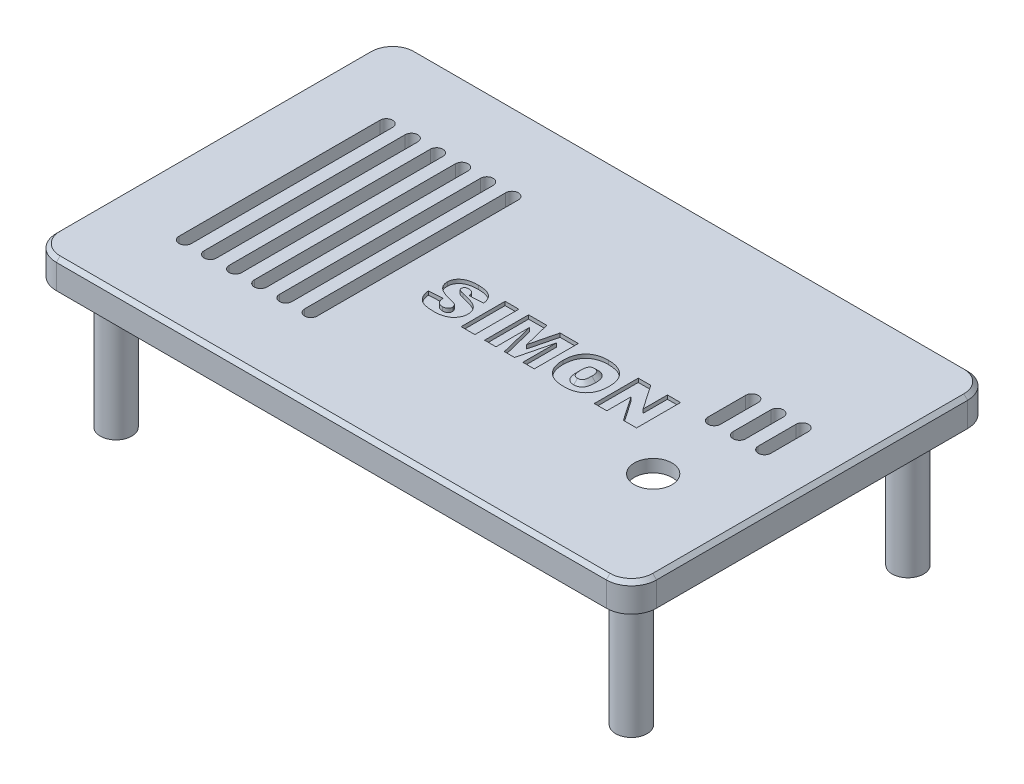
from build123d import *

# Parameters (mm, degrees)
TAPA_DEPTH                        = 2
ESCALON_GROOVE_START              = -2.5
ESCALON_GROOVE_DEPTH              = 2.5
CROQUIS_POSTES_R                  = 2.500000000000002
POSTES_PCB_DEPTH                  = 23.299999999999997
VENTANA_LDR_Y_VENTILAS_DEPTH      = 61.4112158460662
VENTANA_LDR_Y_VENTILAS_DEPTH_BACK = 61.4112158460662
CROQUIS_VENTANA_Y_VENTILAS_R      = 3.0000000000000027
CROQUIS_TEXTO_W                   = 2.1818181818181825
CROQUIS_TEXTO_H                   = 7.000000000000001
TEXTO_SIMON_DEPTH                 = 0.6
CHAFLAN_CARA_SUPERIOR_SIZE        = 0.6


with BuildPart() as part:
    # Croquis_tapa → Tapa (new body)
    with BuildSketch(Plane(origin=(0, 0, 0), x_dir=(1, 0, 0), z_dir=(0, 1, 0))):
        with BuildLine():
            Line((-43.75000000000001, -28.75), (43.75000000000001, -28.75))
            ThreePointArc((43.75000000000001, -28.75), (46.5784271247462, -27.57842712474619), (47.75, -24.75))
            Line((47.75, -24.75), (47.75, 24.75))
            ThreePointArc((47.75, 24.75), (46.57842712474619, 27.578427124746185), (43.75000000000001, 28.75))
            Line((43.75000000000001, 28.75), (-43.75000000000001, 28.75))
            ThreePointArc((-43.75000000000001, 28.75), (-46.5784271247462, 27.57842712474619), (-47.75, 24.75))
            Line((-47.75, 24.75), (-47.75, -24.75))
            ThreePointArc((-47.75, -24.75), (-46.57842712474619, -27.578427124746185), (-43.75000000000001, -28.75))
        make_face()
    extrude(amount=TAPA_DEPTH)

    # Croquis_falda → Escalon_groove (add)
    with BuildSketch(Plane(origin=(0, 0, 0), x_dir=(1, 0, 0), z_dir=(0, 1, 0)).offset(ESCALON_GROOVE_START)):
        with BuildLine():
            Line((-43.75000000000001, -28.75), (43.75000000000001, -28.75))
            ThreePointArc((43.75000000000001, -28.75), (46.5784271247462, -27.57842712474619), (47.75, -24.75))
            Line((47.75, -24.75), (47.75, 24.75))
            ThreePointArc((47.75, 24.75), (46.57842712474619, 27.578427124746185), (43.75000000000001, 28.75))
            Line((43.75000000000001, 28.75), (-43.75000000000001, 28.75))
            ThreePointArc((-43.75000000000001, 28.75), (-46.5784271247462, 27.57842712474619), (-47.75, 24.75))
            Line((-47.75, 24.75), (-47.75, -24.75))
            ThreePointArc((-47.75, -24.75), (-46.57842712474619, -27.578427124746185), (-43.75000000000001, -28.75))
        make_face()
        with BuildLine():
            Line((-43.75000000000001, -27.7), (43.75000000000001, -27.7))
            ThreePointArc((43.75000000000001, -27.7), (45.83596500450032, -26.835965004500316), (46.7, -24.75))
            Line((46.7, -24.75), (46.7, 24.75))
            ThreePointArc((46.7, 24.75), (45.835965004500316, 26.835965004500313), (43.75000000000001, 27.7))
            Line((43.75000000000001, 27.7), (-43.75000000000001, 27.7))
            ThreePointArc((-43.75000000000001, 27.7), (-45.83596500450032, 26.835965004500316), (-46.7, 24.75))
            Line((-46.7, 24.75), (-46.7, -24.75))
            ThreePointArc((-46.7, -24.75), (-45.83596500450032, -26.835965004500313), (-43.75000000000001, -27.7))
        make_face(mode=Mode.SUBTRACT)
    extrude(amount=ESCALON_GROOVE_DEPTH)

    # Croquis_postes → Postes_PCB (add)
    with BuildSketch(Plane(origin=(0, 0, 0), x_dir=(1, 0, 0), z_dir=(0, 1, 0))):
        with Locations(Location((41, 22, 0), (0, 0, 270))):
            Circle(CROQUIS_POSTES_R)
        with Locations(Location((41, -22, 0), (0, 0, 270))):
            Circle(CROQUIS_POSTES_R)
        with Locations(Location((-41, 22, 0), (0, 0, 270))):
            Circle(CROQUIS_POSTES_R)
        with Locations(Location((-41, -22, 0), (0, 0, 270))):
            Circle(CROQUIS_POSTES_R)
    extrude(amount=-POSTES_PCB_DEPTH)

    # Croquis_ventana_y_ventilas → Ventana_LDR_y_ventilas (cut, two sides: drawn at the far end of the back side and taken through both)
    with BuildSketch(Plane(origin=(0, 0, 0), x_dir=(1, 0, 0), z_dir=(0, 1, 0)).offset(-VENTANA_LDR_Y_VENTILAS_DEPTH_BACK)):
        with Locations(Location((33.46, -11, 0), (0, 0, 270))):
            Circle(CROQUIS_VENTANA_Y_VENTILAS_R)
        with BuildLine():
            Line((-17, -16), (-17, 16))
            ThreePointArc((-17, 16), (-16, 17), (-15, 16))
            Line((-15, 16), (-15, -16))
            ThreePointArc((-15, -16), (-16, -17), (-17, -16))
        make_face()
        with BuildLine():
            Line((-21, -16.000000000000007), (-21, 15.999999999999993))
            ThreePointArc((-21, 15.999999999999993), (-20, 16.999999999999993), (-19, 15.999999999999993))
            Line((-19, 15.999999999999993), (-19, -16.000000000000007))
            ThreePointArc((-19, -16.000000000000007), (-20, -17.000000000000007), (-21, -16.000000000000007))
        make_face()
        with BuildLine():
            Line((-25, -16.000000000000014), (-25, 15.999999999999986))
            ThreePointArc((-25, 15.999999999999986), (-24, 16.999999999999986), (-23, 15.999999999999986))
            Line((-23, 15.999999999999986), (-23, -16.000000000000014))
            ThreePointArc((-23, -16.000000000000014), (-24, -17.000000000000014), (-25, -16.000000000000014))
        make_face()
        with BuildLine():
            Line((-29, -16.00000000000002), (-29, 15.999999999999979))
            ThreePointArc((-29, 15.999999999999979), (-28, 16.99999999999998), (-27, 15.999999999999979))
            Line((-27, 15.999999999999979), (-27, -16.00000000000002))
            ThreePointArc((-27, -16.00000000000002), (-28, -17.00000000000002), (-29, -16.00000000000002))
        make_face()
        with BuildLine():
            Line((-33, -16.00000000000003), (-33, 15.999999999999973))
            ThreePointArc((-33, 15.999999999999973), (-32, 16.99999999999997), (-31, 15.999999999999973))
            Line((-31, 15.999999999999973), (-31, -16.00000000000003))
            ThreePointArc((-31, -16.00000000000003), (-32, -17.00000000000003), (-33, -16.00000000000003))
        make_face()
        with BuildLine():
            Line((-37.00000000000001, -16.000000000000036), (-37.00000000000001, 15.999999999999966))
            ThreePointArc((-37.00000000000001, 15.999999999999966), (-36.00000000000001, 16.99999999999997), (-35, 15.999999999999966))
            Line((-35, 15.999999999999966), (-35, -16.000000000000036))
            ThreePointArc((-35, -16.000000000000036), (-36.00000000000001, -17.000000000000036), (-37.00000000000001, -16.000000000000036))
        make_face()
        with BuildLine():
            Line((30, 1.18), (30, 7.18))
            ThreePointArc((30, 7.18), (31, 8.18), (32, 7.18))
            Line((32, 7.18), (32, 1.18))
            ThreePointArc((32, 1.18), (31, 0.17999999999999994), (30, 1.18))
        make_face()
        with BuildLine():
            Line((34, 1.18), (34, 7.18))
            ThreePointArc((34, 7.18), (35, 8.180000000000007), (36.00000000000001, 7.18))
            Line((36.00000000000001, 7.18), (36.00000000000001, 1.18))
            ThreePointArc((36.00000000000001, 1.18), (35, 0.17999999999999994), (34, 1.18))
        make_face()
        with BuildLine():
            Line((38, 1.18), (38, 7.18))
            ThreePointArc((38, 7.18), (39, 8.18), (40, 7.18))
            Line((40, 7.18), (40, 1.18))
            ThreePointArc((40, 1.18), (39, 0.17999999999999994), (38, 1.18))
        make_face()
    extrude(amount=VENTANA_LDR_Y_VENTILAS_DEPTH + VENTANA_LDR_Y_VENTILAS_DEPTH_BACK, mode=Mode.SUBTRACT)

    # Croquis_texto → Texto_SIMON (cut)
    # profile 1 of 5: a face of its own
    with BuildSketch(Plane(origin=(0, 2, 0), x_dir=(1, 0, 0), z_dir=(0, 1, 0))):
        with BuildLine():
            Line((-9.636363636363637, -3.673295454545454), (-7.454545454545455, -3.5454545454545454))
            add(Edge.make_bspline(
                [(-7.454545454545455, -3.5454545454545454), (-7.443334879168272, -3.623888172631611), (-7.422138415725998, -3.772187029306458), (-7.367963968321025, -3.978497338687695), (-7.299675120562156, -4.156745220271855), (-7.235906679516529, -4.257902176777443), (-7.205965909090909, -4.3053977272727275)],
                knots=[0, 0, 0, 0, 1.1770868639817493, 2.2255841329561408, 3.166870363402418, 3.9999999999999996, 3.9999999999999996, 3.9999999999999996, 3.9999999999999996], degree=3))
            add(Edge.make_bspline(
                [(-7.205965909090909, -4.3053977272727275), (-7.179788136074212, -4.339245246532298), (-7.128590569553015, -4.405443032637478), (-7.038959563551368, -4.491551022292443), (-6.941728468338179, -4.564655482865963), (-6.836351920691705, -4.624657492520284), (-6.7225094161414445, -4.670401084517026), (-6.600897908066968, -4.702899356221522), (-6.470842928730454, -4.723176034233415), (-6.381231068109656, -4.725883039430784), (-6.3352272727272725, -4.7272727272727275)],
                knots=[0, 0, 0, 0, 1.0183953625098916, 1.9917417835245903, 2.950663556748308, 3.9105802343792413, 4.872152798487884, 5.865559653282376, 6.904248206810336, 8, 8, 8, 8], degree=3))
            add(Edge.make_bspline(
                [(-6.3352272727272725, -4.7272727272727275), (-6.268755987561935, -4.724527547837119), (-6.142081216189316, -4.71929604108172), (-5.963166534666255, -4.680680424342079), (-5.809111818670184, -4.6113955866092065), (-5.680697914780001, -4.517120500014326), (-5.582820117951429, -4.402639676289624), (-5.506907512844863, -4.280522336689352), (-5.462733749523046, -4.146860477539383), (-5.4572818673821395, -4.054753254710224), (-5.454545454545454, -4.008522727272727)],
                knots=[0, 0, 0, 0, 1.255494895783263, 2.392604994581436, 3.4334622420041474, 4.424586181737781, 5.3754559945137474, 6.262142743519165, 7.127733362157612, 8, 8, 8, 8], degree=3))
            add(Edge.make_bspline(
                [(-5.454545454545454, -4.008522727272727), (-5.457042638060894, -3.9642188454008944), (-5.461992267179779, -3.876404801124006), (-5.500792405763518, -3.748839170668373), (-5.564055951819271, -3.6286714006327605), (-5.623106642104371, -3.5586562456175215), (-5.653409090909091, -3.5227272727272725)],
                knots=[0, 0, 0, 0, 0.9883148386515781, 1.9589236729170945, 2.9526013902743147, 4, 4, 4, 4], degree=3))
            add(Edge.make_bspline(
                [(-5.653409090909091, -3.5227272727272725), (-5.672796040636891, -3.504573296140464), (-5.715720269131202, -3.464378966963703), (-5.798824742560139, -3.413369120195042), (-5.901181072722431, -3.360762396750202), (-6.025102965381517, -3.310554621350773), (-6.169482323778489, -3.2612092967013973), (-6.334241626646502, -3.2114276061604117), (-6.52070539191982, -3.1637005515103014), (-6.652387590259261, -3.133676403076435), (-6.721590909090909, -3.117897727272727)],
                knots=[0, 0, 0, 0, 0.5512304499143283, 1.2204674854659632, 2.017678125629164, 2.944918582915026, 3.9976076496643045, 5.190855942878632, 6.523702563592668, 7.999999999999999, 7.999999999999999, 7.999999999999999, 7.999999999999999], degree=3))
            add(Edge.make_bspline(
                [(-6.721590909090909, -3.117897727272727), (-6.836435564016809, -3.09146247115067), (-7.058221729738386, -3.040411126192894), (-7.375736164808842, -2.949680781612333), (-7.668394483475909, -2.8560924360017523), (-7.9353165507370385, -2.7534686658991365), (-8.176903725721141, -2.644644561531827), (-8.393182897093535, -2.5300443870251064), (-8.584944625542091, -2.4099229459496834), (-8.697283245167544, -2.319259761792594), (-8.751420454545455, -2.2755681818181817)],
                knots=[0, 0, 0, 0, 1.2752657802061986, 2.462772933144874, 3.57286581951249, 4.5997375036263355, 5.556111329171218, 6.438742692037826, 7.247613028754068, 8, 8, 8, 8], degree=3))
            add(Edge.make_bspline(
                [(-8.751420454545455, -2.2755681818181817), (-8.800207842772847, -2.2310769800005468), (-8.896161431118928, -2.143573003679166), (-9.02139750812741, -1.9977483179322726), (-9.128119336944392, -1.8434502041239278), (-9.21285732894506, -1.6791740161465678), (-9.281027625940188, -1.506655483934994), (-9.328747533654775, -1.3250198895494663), (-9.357907758951438, -1.1339886644771786), (-9.36170068579192, -1.0038929133587353), (-9.363636363636363, -0.9375)],
                knots=[0, 0, 0, 0, 1.0411739214007056, 2.0477499919674957, 3.0259724410385243, 3.995164289565199, 4.958114780489323, 5.947685897473527, 6.952624422992133, 8, 8, 8, 8], degree=3))
            add(Edge.make_bspline(
                [(-9.363636363636363, -0.9375), (-9.359695985294676, -0.8495949654654166), (-9.3518140267966, -0.6737580853760523), (-9.291448831405713, -0.41500705324892695), (-9.192860981080903, -0.16446909573423832), (-9.081046842366272, 0.03536937585750832), (-8.97319111303511, 0.1889129469366951), (-8.880434992723893, 0.2986524729188811), (-8.777352851242092, 0.40122737568511785), (-8.664796719132505, 0.49802563129663674), (-8.542756590358065, 0.5885770992307596), (-8.411293682496703, 0.6734607791582755), (-8.268889740525212, 0.7489398439230583), (-8.117435381397556, 0.8212836060855373), (-7.95334164362542, 0.8853222885745315), (-7.775261745357778, 0.9404060881561882), (-7.582655139782734, 0.9872546186625996), (-7.375804490401286, 1.0249602094546093), (-7.154455825349969, 1.0548550960355996), (-6.918886416499556, 1.0756437401883716), (-6.668707730712644, 1.0886401361356999), (-6.497175747200471, 1.0901392620796508), (-6.409090909090909, 1.0909090909090913)],
                knots=[0, 0, 0, 0, 1.3090717199279431, 2.618542706502086, 3.93669142772237, 5.310779260025486, 6.019465884265697, 6.73046699421611, 7.44892136871403, 8.184394081775846, 8.940790576948082, 9.711951076898002, 10.513842775099734, 11.340797704352406, 12.212135637171828, 13.13605295778236, 14.116643754116284, 15.164270918131468, 16.267925536227978, 17.44397513047766, 18.687434073658263, 20, 20, 20, 20], degree=3))
            add(Edge.make_bspline(
                [(-6.409090909090909, 1.0909090909090913), (-6.301080019374197, 1.0899294320415263), (-6.091867679987706, 1.0880318759337897), (-5.787996362405475, 1.0625112910304502), (-5.503686717643599, 1.0253859653249333), (-5.239014564214066, 0.972136817661253), (-4.994777718848705, 0.9017982358196842), (-4.768877845667273, 0.8194108730549894), (-4.563912609920191, 0.7177374613887577), (-4.376824030582997, 0.6025602840618627), (-4.20898282249446, 0.46907144751620616), (-4.058740130804281, 0.31786617801805633), (-3.92774811279431, 0.14760162871200486), (-3.8143817221546223, -0.04064876416237256), (-3.7199495550460124, -0.2473441562765462), (-3.6415021356573014, -0.4716123671508302), (-3.581375451310744, -0.7141765689827172), (-3.557651385223595, -0.8832484705463705), (-3.5454545454545454, -0.9701704545454545)],
                knots=[0, 0, 0, 0, 1.3115156678148931, 2.5403481234645695, 3.7009575805541344, 4.792716182989153, 5.815693948855718, 6.785616820490555, 7.708932939056227, 8.589794160376693, 9.449314928461911, 10.307353016100883, 11.172377749673979, 12.052130673662482, 12.97072446773444, 13.927412188468951, 14.934456625113587, 16, 16, 16, 16], degree=3))
            Line((-3.5454545454545454, -0.9701704545454545), (-5.727272727272727, -1.0909090909090904))
            add(Edge.make_bspline(
                [(-5.727272727272727, -1.0909090909090904), (-5.741071735226454, -1.0166260944800347), (-5.767049551845123, -0.8767819791936254), (-5.83166791352429, -0.6840544886166381), (-5.919392345109169, -0.5242321159653845), (-6.028951493814268, -0.3955275962083252), (-6.160680945127358, -0.29785826259322973), (-6.314647030399677, -0.22895623209763424), (-6.4909734610531595, -0.18977953933333805), (-6.615331183199284, -0.1845528790667585), (-6.6803977272727275, -0.18181818181818143)],
                knots=[0, 0, 0, 0, 1.2345229490025666, 2.324095390644541, 3.3084612467630055, 4.197778927427227, 5.066467890217188, 5.967370860889678, 6.936486201399829, 7.999999999999999, 7.999999999999999, 7.999999999999999, 7.999999999999999], degree=3))
            add(Edge.make_bspline(
                [(-6.6803977272727275, -0.18181818181818143), (-6.733575955985485, -0.18349207231177422), (-6.833785527776119, -0.18664636785052544), (-6.974617533331878, -0.21610329014979843), (-7.09462398573231, -0.26718958650149705), (-7.193066179924691, -0.337742885425528), (-7.268709490148404, -0.42252617687975474), (-7.325043242758786, -0.5166045255795823), (-7.356554859599625, -0.6211632758004495), (-7.361254029871722, -0.693460953361109), (-7.363636363636364, -0.7301136363636364)],
                knots=[0, 0, 0, 0, 1.2953495816680956, 2.4409693598349427, 3.4852848728728163, 4.452772794322755, 5.368250368663451, 6.2373621078105375, 7.106397188810696, 8, 8, 8, 8], degree=3))
            add(Edge.make_bspline(
                [(-7.363636363636364, -0.7301136363636364), (-7.361767954008994, -0.7574078549645263), (-7.358014496259981, -0.8122393516609977), (-7.325203290960944, -0.8911520894264557), (-7.275285411588779, -0.9664041668339952), (-7.228822839343832, -1.0080624651916774), (-7.204545454545455, -1.0298295454545447)],
                knots=[0, 0, 0, 0, 0.9313593215496262, 1.8710125506619575, 2.887572404170655, 4, 4, 4, 4], degree=3))
            add(Edge.make_bspline(
                [(-7.204545454545455, -1.0298295454545447), (-7.189610486380151, -1.041496335709884), (-7.1572585020302615, -1.0667688245144495), (-7.099372758826626, -1.101115579441741), (-7.027487715433766, -1.1330406178639936), (-6.943105165478338, -1.1653475814897372), (-6.845273239563917, -1.1965454926950436), (-6.734770744085803, -1.2273205662121507), (-6.611338994155007, -1.2589560578729204), (-6.524226133367083, -1.2773286583364538), (-6.478693181818182, -1.2869318181818181)],
                knots=[0, 0, 0, 0, 0.5855837203052892, 1.2684858210062226, 2.0741956093958027, 3.0148962604420184, 4.061191977223796, 5.247631417213221, 6.561366666285349, 8, 8, 8, 8], degree=3))
            add(Edge.make_bspline(
                [(-6.478693181818182, -1.2869318181818181), (-6.364526256776745, -1.31224472088474), (-6.1444039954519845, -1.3610498663473023), (-5.826760073454946, -1.4358018025243373), (-5.535022954526224, -1.5121436462538516), (-5.2684636193855265, -1.5891589814880407), (-5.026409258501662, -1.6649963076471896), (-4.810206064464688, -1.743107815314852), (-4.617986928748538, -1.8190808968224257), (-4.450085450232665, -1.898301179332722), (-4.299070861010282, -1.9790268396699278), (-4.161416279669968, -2.064522383815481), (-4.033381618457984, -2.153544589975777), (-3.9159056507473378, -2.24774584512524), (-3.8095188004297333, -2.347393544344418), (-3.712478310377793, -2.4507673952595863), (-3.626497299891709, -2.559614982933532), (-3.5271392891491953, -2.7101729504683245), (-3.4251386011442784, -2.909072757506448), (-3.335763095013531, -3.1619935962959356), (-3.2818887337364093, -3.4295383847610603), (-3.2758111503039555, -3.612916487933229), (-3.2727272727272725, -3.705965909090909)],
                knots=[0, 0, 0, 0, 1.59216922401928, 3.069819826325439, 4.442701820227377, 5.697484839518971, 6.847378755218487, 7.895511839985007, 8.826870635109142, 9.660312258422223, 10.421783000006778, 11.157070095266254, 11.865294080332674, 12.543880036336077, 13.205252393812037, 13.848401971930857, 14.472630749782457, 15.091275345676452, 16.302236042830973, 17.505191011927693, 18.734088049644864, 19.999999999999996, 19.999999999999996, 19.999999999999996, 19.999999999999996], degree=3))
            add(Edge.make_bspline(
                [(-3.2727272727272725, -3.705965909090909), (-3.273823563509547, -3.7614031692057592), (-3.2759933094944684, -3.8711229392650357), (-3.2932135665392726, -4.034111068369788), (-3.323413443532376, -4.193514213047641), (-3.3646848030738306, -4.350167413578228), (-3.4170859350873144, -4.503632918508403), (-3.481626447840394, -4.6534537848830535), (-3.5569873449134985, -4.800441688924507), (-3.6444772500641305, -4.942842248475109), (-3.7429962115705666, -5.0789309437093735), (-3.8486005981271223, -5.209085443826205), (-3.9667298515129525, -5.32790741879485), (-4.090967691114805, -5.441889610891039), (-4.228604171109557, -5.542329669157089), (-4.371622391080177, -5.639356688204205), (-4.526603019691938, -5.723679380514798), (-4.689480252409125, -5.802712342287931), (-4.863710498878686, -5.870160329611856), (-5.047398428395101, -5.9306013021723345), (-5.2427081180207304, -5.979482603243517), (-5.448783375932715, -6.021128542238441), (-5.66611448573437, -6.051563192428639), (-5.894036898303722, -6.074157244823161), (-6.13238031986896, -6.088956318622567), (-6.294958656648562, -6.0902497175810675), (-6.377840909090909, -6.090909090909092)],
                knots=[0, 0, 0, 0, 0.9060699158918729, 1.79326652549799, 2.6752149076033094, 3.5556677695632706, 4.439244741281412, 5.323397785795382, 6.219930382744195, 7.137170545372751, 8.052187567754274, 8.964877591415792, 9.873423338271003, 10.788702186832113, 11.71746204584966, 12.6555273837023, 13.611744183526287, 14.598361817812151, 15.613055282879133, 16.663057223607126, 17.757447018868227, 18.90192347463983, 20.098271487158687, 21.342794295827503, 22.64535953358268, 24, 24, 24, 24], degree=3))
            add(Edge.make_bspline(
                [(-6.377840909090909, -6.090909090909092), (-6.5213545203480905, -6.0885976045232795), (-6.797378342629765, -6.084151856821897), (-7.19424121978707, -6.054145065595998), (-7.556211799861083, -5.999936997120818), (-7.884872342095792, -5.928185777465733), (-8.178706412902613, -5.831290254628128), (-8.440230867695023, -5.7159124541592385), (-8.666861098472895, -5.576827291549666), (-8.858406681825132, -5.414220894247351), (-9.022295270265092, -5.236213412799885), (-9.165396589743775, -5.046121320321677), (-9.293762203809564, -4.846956843329333), (-9.399829541644749, -4.6340310452204845), (-9.488215696938042, -4.410181097318496), (-9.558093145435993, -4.175030920453881), (-9.607791637519393, -3.9281345153162515), (-9.6267349617346, -3.7591754243826427), (-9.636363636363637, -3.673295454545454)],
                knots=[0, 0, 0, 0, 1.5058034673226501, 2.896154762007625, 4.172048974132561, 5.343508696749554, 6.421214707972998, 7.412908531146506, 8.336567114734306, 9.200370627603807, 10.04053633819003, 10.870193374875488, 11.694343727936253, 12.523048298742156, 13.361626237615692, 14.216714319043014, 15.093576322851693, 16, 16, 16, 16], degree=3))
        make_face()
    # profile 2 of 5: a face of its own
    with BuildSketch(Plane(origin=(0, 2, 0), x_dir=(1, 0, 0), z_dir=(0, 1, 0))):
        with Locations((-1, -2.4999999999999996)):
            Rectangle(CROQUIS_TEXTO_W, CROQUIS_TEXTO_H)
    # profile 3 of 5: a face of its own
    with BuildSketch(Plane(origin=(0, 2, 0), x_dir=(1, 0, 0), z_dir=(0, 1, 0))):
        Polygon((1.6363636363636371, 1.0000000000000009), (4.544034090909092, 1.0000000000000009), (5.595170454545455, -3.2485795454545454), (6.644886363636365, 1.0000000000000009), (9.545454545454547, 1.0000000000000009), (9.545454545454547, -6), (7.72727272727273, -6), (7.72727272727273, -0.6406249999999997), (6.401988636363638, -6), (4.779829545454547, -6), (3.454545454545455, -0.6406249999999997), (3.454545454545455, -6), (1.6363636363636371, -6), align=None)
    # profile 4 of 5: a face of its own
    with BuildSketch(Plane(origin=(0, 2, 0), x_dir=(1, 0, 0), z_dir=(0, 1, 0))):
        with BuildLine():
            add(Edge.make_bspline(
                [(10.636363636363637, -2.5042613636363633), (10.639460607674883, -2.366363347806043), (10.645490137062664, -2.0978881004097545), (10.689483689591832, -1.7065861237074569), (10.764507539053978, -1.3385597077826314), (10.869331838336498, -0.9940629588044527), (11.003022105848475, -0.6724582050532968), (11.168962529672356, -0.37547789329591535), (11.364228574928719, -0.10111166501430156), (11.589258992071198, 0.14817186482587602), (11.841646631584785, 0.36961490985809436), (12.116776208515573, 0.5648893956602735), (12.418054463123509, 0.7267920627420155), (12.741608381188827, 0.8606497965770371), (13.088656391061768, 0.9643343946485303), (13.458743187917165, 1.036982700679966), (13.852002136119056, 1.0841464931943483), (14.122490535072313, 1.088614925686248), (14.26136363636364, 1.0909090909090913)],
                knots=[0, 0, 0, 0, 1.141509497606743, 2.2224180886857847, 3.2548744861864254, 4.246852721239051, 5.199093221333552, 6.132658289147604, 7.057234514417991, 7.981445044859864, 8.906287139182032, 9.831793571989309, 10.768447855708017, 11.731542758355008, 12.726135354727411, 13.761653046554935, 14.850796616809317, 16, 16, 16, 16], degree=3))
            add(Edge.make_bspline(
                [(14.26136363636364, 1.0909090909090913), (14.403061917326605, 1.0884733282423402), (14.679131991178787, 1.0837277436471953), (15.080453619977945, 1.0385344889869785), (15.457659581185377, 0.9673301335348446), (15.809290727018983, 0.8652751869859759), (16.13623407067102, 0.7343260404981528), (16.437292034466815, 0.5733027333004833), (16.714081914235898, 0.3831891216848262), (16.964076428067273, 0.16369766635784877), (17.1879990267127, -0.08048832606656481), (17.381052065033845, -0.35047226388781977), (17.544991809362166, -0.6429069936758375), (17.679014841198917, -0.9592263889369261), (17.782524663594273, -1.2987944146694437), (17.85505601000403, -1.6613621405725398), (17.902362496245765, -2.0465734158257787), (17.90680759599719, -2.3114064660827043), (17.90909090909091, -2.4474431818181817)],
                knots=[0, 0, 0, 0, 1.1762858115034174, 2.291751943962522, 3.3489565652634177, 4.3605475423483675, 5.3272434560292785, 6.268348986953007, 7.189933859112019, 8.109453091483415, 9.025105683474758, 9.935135630691034, 10.859333697713936, 11.80361251231324, 12.782426517391587, 13.80183482549847, 14.870869135505602, 16, 16, 16, 16], degree=3))
            add(Edge.make_bspline(
                [(17.90909090909091, -2.4474431818181817), (17.90750582467957, -2.5464239436281955), (17.904401146953468, -2.74029586887463), (17.88663272632455, -3.024402484134306), (17.853649838770703, -3.295078874279767), (17.808736242495783, -3.5522354848834907), (17.750556264369777, -3.795643145148656), (17.679929415363127, -4.025730187513329), (17.594287918052245, -4.241277328182131), (17.497946865938594, -4.444505449136456), (17.387270367096402, -4.634042597708653), (17.266967574920354, -4.813481433664436), (17.13399431623169, -4.981623626375643), (16.990580411641044, -5.1395895628139385), (16.835279894246106, -5.286907123759671), (16.66685787646283, -5.421012009190142), (16.488992931699123, -5.547326181501544), (16.29848348571726, -5.66070005028227), (16.096194671178893, -5.761709039800897), (15.882118871997687, -5.850000983133106), (15.655858080423732, -5.925473582845329), (15.417002238215767, -5.986243434042447), (15.166344675768938, -6.032535096169966), (14.904202055428803, -6.066928634526702), (14.629564956182989, -6.086627374759854), (14.44226579882331, -6.089461422033965), (14.346590909090912, -6.090909090909092)],
                knots=[0, 0, 0, 0, 1.2271705805450368, 2.4036380272836126, 3.5270704034307947, 4.606008097853839, 5.638218407414541, 6.627805636178698, 7.587035219341011, 8.511212202784343, 9.413314863261817, 10.30548933947667, 11.187409042471497, 12.068331905466174, 12.948628723884662, 13.83786319036211, 14.735197903834312, 15.651286310776959, 16.5832044291849, 17.535946325181566, 18.51975415377185, 19.537695563225785, 20.588810061930523, 21.678029866754635, 22.81390690918291, 24, 24, 24, 24], degree=3))
            add(Edge.make_bspline(
                [(14.346590909090912, -6.090909090909092), (14.24997883134268, -6.089813708918799), (14.060387448217883, -6.087664133095261), (13.78252485437034, -6.070971072887096), (13.5171439444792, -6.040769934881189), (13.264787333995715, -6.000260824874056), (13.024869955011711, -5.947409856379935), (12.797909464025885, -5.884137368926421), (12.58323569188004, -5.808619172373447), (12.380863573704644, -5.720540853287922), (12.189696386396005, -5.619071852917194), (12.008267736143106, -5.505365187547292), (11.837155770828748, -5.376616131560404), (11.675208983312137, -5.234193701039648), (11.521580662087942, -5.078876956425473), (11.375988264882746, -4.911062038317805), (11.240935928879155, -4.728547319296154), (11.116261284325251, -4.5324638451011925), (11.001881590265603, -4.3240513289122084), (10.90391336882576, -4.101535981164713), (10.82159514936454, -3.8657865003768133), (10.753729485396445, -3.6180416911726607), (10.701251587909764, -3.357424230820082), (10.663071602537263, -3.084737566459973), (10.639940043643703, -2.7986988796590264), (10.637571923505805, -2.6037369090433526), (10.636363636363637, -2.5042613636363633)],
                knots=[0, 0, 0, 0, 1.1823544088062532, 2.320250355172457, 3.404920019835303, 4.449983545126182, 5.446830610656614, 6.4099612102321695, 7.331835133876033, 8.229702173152354, 9.108460858144069, 9.978232002170998, 10.847443168270106, 11.726182747112357, 12.6153498471981, 13.519180864622887, 14.442874230163987, 15.391301827997088, 16.361103301107498, 17.349561128181648, 18.36304461618704, 19.414578589861595, 20.49079478194908, 21.61433217254373, 22.782759491265413, 24, 24, 24, 24], degree=3))
        make_face()
        with BuildLine():
            add(Edge.make_bspline(
                [(12.81818181818182, -2.5042613636363633), (12.819088361891486, -2.588103722656582), (12.820837286726574, -2.749854317094827), (12.839318006095624, -2.9832940299309896), (12.870237235375855, -3.198260439052658), (12.9126648293332, -3.394832871008434), (12.965283662687302, -3.574042691470484), (13.034500786378908, -3.733853304240795), (13.112905495627844, -3.876836832330338), (13.205390465457183, -4.000938922695785), (13.308516528727518, -4.107584089204449), (13.419944917241448, -4.201234660111424), (13.541403745765013, -4.279414678920003), (13.671484310201715, -4.343752521180435), (13.810198143638235, -4.393630253050092), (13.957369709001867, -4.42890550573349), (14.11345326072065, -4.450780814011365), (14.220569805638915, -4.4532682795952905), (14.275568181818183, -4.454545454545454)],
                knots=[0, 0, 0, 0, 1.450299893483712, 2.7979516872628087, 4.047956828123061, 5.2048141795994605, 6.275045649585114, 7.273222876655889, 8.21209241345935, 9.090248036666704, 9.941908401880353, 10.773637600004323, 11.602983325627614, 12.434591495080006, 13.279329446247988, 14.147571640880427, 15.048881273964389, 16, 16, 16, 16], degree=3))
            add(Edge.make_bspline(
                [(14.275568181818183, -4.454545454545454), (14.331514365754407, -4.453266133216183), (14.440988100845477, -4.450762797430912), (14.599761970237948, -4.428832038565029), (14.749361884456977, -4.395093957802201), (14.889127701423057, -4.346855825472571), (15.019357944161415, -4.284051302727069), (15.139679309660961, -4.206891528115838), (15.249218939057783, -4.115138620948412), (15.35076023832156, -4.010135782900948), (15.44181647455346, -3.8864146059538474), (15.517884550343323, -3.739292202331401), (15.582560676745894, -3.570935221806591), (15.636421849646503, -3.381293867959779), (15.676742360807989, -3.169692477912136), (15.705903301303756, -2.9362679028564984), (15.724731138112972, -2.680704863934736), (15.726403893018142, -2.5028761612766735), (15.727272727272728, -2.4105113636363633)],
                knots=[0, 0, 0, 0, 0.9343700973985084, 1.8283460519171058, 2.6727444141538212, 3.4933860167050708, 4.293052863066398, 5.0830736691346665, 5.8751911265812975, 6.6753274447128295, 7.518724565703245, 8.431784963600467, 9.433743099565602, 10.528049476186178, 11.721186616425879, 13.029232024476077, 14.456973599907565, 16, 16, 16, 16], degree=3))
            add(Edge.make_bspline(
                [(15.727272727272728, -2.4105113636363633), (15.72636371279273, -2.332346874784881), (15.724603517351474, -2.1809908953453654), (15.705991524574092, -1.9622274450124253), (15.675533960637633, -1.7598237667973853), (15.631191388003243, -1.5742296846352155), (15.576415038320942, -1.4040767410571053), (15.508582316470532, -1.2498550895163132), (15.427398408185867, -1.1125459933060213), (15.333962385647967, -0.9916883384397529), (15.229835874658216, -0.8865442839993117), (15.117038244599009, -0.7949587688710752), (14.995283485531646, -0.7171045744257754), (14.863924255062607, -0.6556200497550464), (14.725190139114881, -0.6041218731928455), (14.575992967938438, -0.5715228313863557), (14.418760786536195, -0.5492234066743343), (14.310688750693974, -0.5467257915070349), (14.255681818181822, -0.5454545454545452)],
                knots=[0, 0, 0, 0, 1.3866120099114299, 2.6850046862266272, 3.8922135905330166, 5.014997860429714, 6.06706670327333, 7.059978218722937, 7.9979495742341085, 8.890262602465024, 9.763547239312105, 10.617710116248038, 11.463736341746182, 12.320498160296887, 13.186844933843807, 14.08353719678589, 15.024551177768558, 16, 16, 16, 16], degree=3))
            add(Edge.make_bspline(
                [(14.255681818181822, -0.5454545454545452), (14.20304767220597, -0.5467552957719785), (14.099700946844388, -0.5493093086343025), (13.948387435374334, -0.5713021503524152), (13.804835564034827, -0.6060721855351127), (13.669639690360057, -0.6565828130033105), (13.542458125664101, -0.7208994803145831), (13.422589447079863, -0.7991752076176198), (13.31131851178408, -0.8923628644162955), (13.207816393327363, -0.999594547465924), (13.115079019283733, -1.1237472431377153), (13.035071887098512, -1.2666896018241633), (12.967223517771513, -1.4277381884177334), (12.912149931738787, -1.6077111908765491), (12.870411424675407, -1.8060645497442929), (12.839273724591369, -2.0223774841222317), (12.820853081834835, -2.2572544035236817), (12.819093635422893, -2.419947258347115), (12.81818181818182, -2.5042613636363633)],
                knots=[0, 0, 0, 0, 0.9142685359277805, 1.7951589702360755, 2.6512986956873834, 3.476635500231191, 4.297241834827498, 5.123398564871082, 5.958845571891921, 6.814312837825198, 7.707908803529882, 8.64380444936425, 9.654011713921754, 10.73930675696677, 11.909377047630842, 13.173112581612301, 14.534991080625744, 16, 16, 16, 16], degree=3))
        make_face(mode=Mode.SUBTRACT)
    # profile 5 of 5: a face of its own
    with BuildSketch(Plane(origin=(0, 2, 0), x_dir=(1, 0, 0), z_dir=(0, 1, 0))):
        Polygon((19.090909090909097, 1.0000000000000009), (21.07670454545455, 1.0000000000000009), (23.72727272727273, -2.8721590909090904), (23.72727272727273, 1.0000000000000009), (25.818181818181817, 1.0000000000000009), (25.818181818181817, -6), (23.72727272727273, -6), (21.09090909090909, -2.149147727272727), (21.09090909090909, -6), (19.090909090909097, -6), align=None)
    extrude(amount=-TEXTO_SIMON_DEPTH, mode=Mode.SUBTRACT)

    # Chaflan_cara_superior
    chaflan_cara_superior_edges = [part.edges().sort_by_distance(p)[0] for p in [
        (0, 2, 28.75),
        (-46.57842712474619, 2, 27.578427124746185),
        (46.5784271247462, 2, 27.57842712474619),
        (-47.75, 2, 0),
        (47.75, 2, 0),
        (-46.5784271247462, 2, -27.57842712474619),
        (46.57842712474619, 2, -27.578427124746185),
        (0, 2, -28.75),
    ]]
    chamfer(chaflan_cara_superior_edges, length=CHAFLAN_CARA_SUPERIOR_SIZE)
    chaflan_cara_superior_2_edges = [part.edges().sort_by_distance(p)[0] for p in [
        (13.098432499853985, 2, 3.8466271261743596),
    ]]
    chamfer(chaflan_cara_superior_2_edges, length=CHAFLAN_CARA_SUPERIOR_SIZE - 0.0004)  # a hair under: the kernel refuses the full size


solid = part.part
